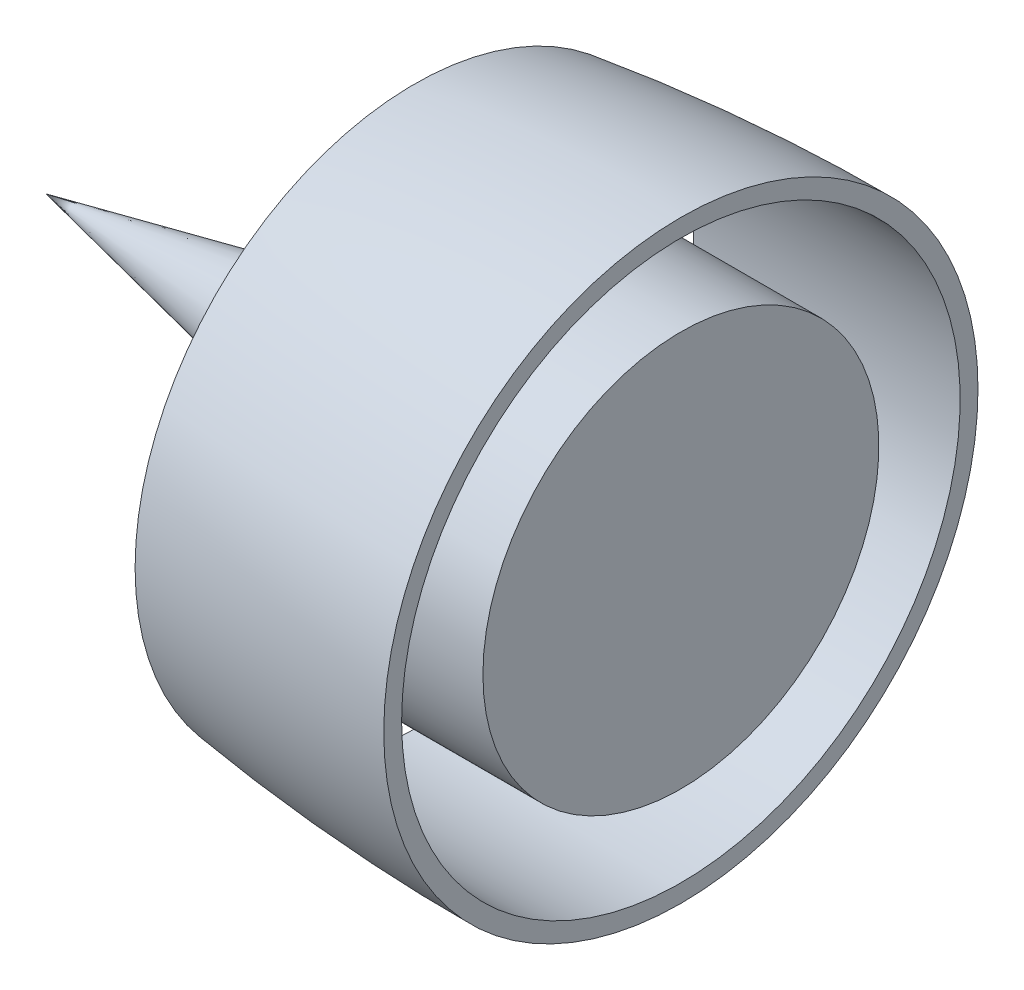
from build123d import *


with BuildPart() as part:
    # Schizzo1 → Rivoluzione1 (revolve)
    with BuildSketch(Plane.XY):
        Polygon((248.848174368, 51.987092175), (0, 0), (711.620911083, 0), (711.620911083, 221.902195545), (500.601236591, 221.902195545), (402.703923876, 127.693506502), align=None)
        with BuildLine():
            ThreePointArc((711.620911083, 333.038653032), (561.925402669, 328.033062372), (412.898663908, 313.038653032))
            Line((412.898663908, 313.038653032), (711.620911083, 313.038653032))
            Line((711.620911083, 313.038653032), (711.620911083, 333.038653032))
        make_face()
    revolve(axis=Axis((-275.018458385, 0, 0), (1, 0, 0)))


solid = part.part
